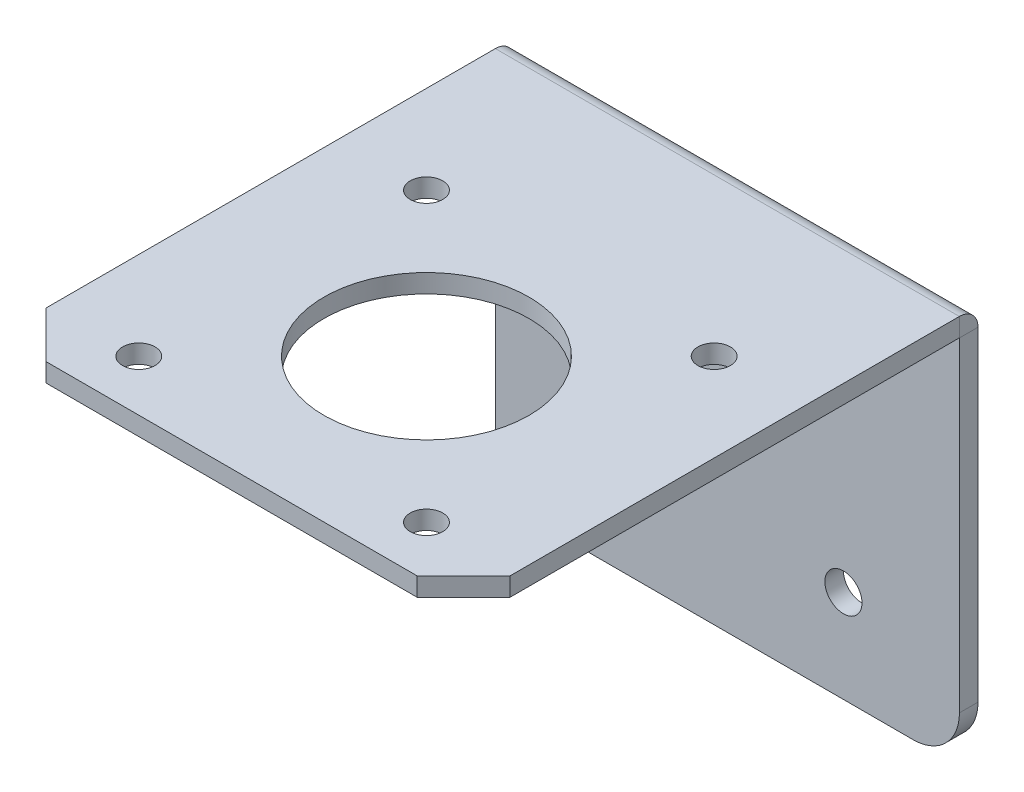
from build123d import *

# Parameters (mm, degrees)
SCHIZZO1_R                             = 1.75
SCHIZZO1_R_2                           = 11.05
SCHIZZO1_R_3                           = 2
BASE_FLANGIA1_DEPTH                    = 2
PIEGATURA_START                        = -5.5
PIEGATURA_DELLO_SCHIZZO1_OUTLINE_W     = 50
PIEGATURA_DELLO_SCHIZZO1_OUTLINE_H     = 2
PIEGATURA_DELLO_SCHIZZO1_DEPTH         = 53
PIEGATURA_START_2                      = -7.5
PIEGATURA_DELLO_SCHIZZO1_2_OUTLINE_R   = 1.75
PIEGATURA_DELLO_SCHIZZO1_2_OUTLINE_R_2 = 11.05
PIEGATURA_DELLO_SCHIZZO1_2_DEPTH       = 2
PIEGATURA_START_3                      = -26
PIEGATURA_DELLO_SCHIZZO1_3_DEPTH       = 52
PIEGATURA_START_4                      = -25
PIEGATURA_DELLO_SCHIZZO1_4_DEPTH       = 50


with BuildPart() as part:
    # Base-Flangia1: sheet metal written as solids
    # Schizzo1 → Base-Flangia1 (new body)
    with BuildSketch(Plane.XY):
        with BuildLine():
            Line((-25, 42.5), (-20, 47.5))
            Line((-20, 47.5), (20, 47.5))
            Line((20, 47.5), (25, 42.5))
            Line((25, 42.5), (25, -42.5))
            ThreePointArc((25, -42.5), (23.535533906, -46.035533906), (20, -47.5))
            Line((20, -47.5), (-20, -47.5))
            ThreePointArc((-20, -47.5), (-23.535533906, -46.035533906), (-25, -42.5))
            Line((-25, -42.5), (-25, 42.5))
        make_face()
        with Locations((-15.5, 42)):
            Circle(SCHIZZO1_R, mode=Mode.SUBTRACT)
        with Locations((15.5, 42)):
            Circle(SCHIZZO1_R, mode=Mode.SUBTRACT)
        with Locations((15.5, 11)):
            Circle(SCHIZZO1_R, mode=Mode.SUBTRACT)
        with Locations((-15.5, 11)):
            Circle(SCHIZZO1_R, mode=Mode.SUBTRACT)
        with Locations((0, 26.5)):
            Circle(SCHIZZO1_R_2, mode=Mode.SUBTRACT)
        with Locations((-12.5, -37.5)):
            Circle(SCHIZZO1_R_3, mode=Mode.SUBTRACT)
        with Locations((12.5, -37.5)):
            Circle(SCHIZZO1_R_3, mode=Mode.SUBTRACT)
    extrude(amount=-BASE_FLANGIA1_DEPTH)

    # Piegatura dello schizzo1: read off the stored shape, not the designer's step
    # Piegatura dello schizzo1 outline → Piegatura dello schizzo1 (cut)
    with BuildSketch(Plane(origin=(0, 0, 0), x_dir=(1, 0, 0), z_dir=(0, 1, 0)).offset(PIEGATURA_START)):
        with Locations((0, 1)):
            Rectangle(PIEGATURA_DELLO_SCHIZZO1_OUTLINE_W, PIEGATURA_DELLO_SCHIZZO1_OUTLINE_H)
    extrude(amount=PIEGATURA_DELLO_SCHIZZO1_DEPTH, mode=Mode.SUBTRACT)

    # Piegatura dello schizzo1 2 outline → Piegatura dello schizzo1 2 (add)
    with BuildSketch(Plane(origin=(0, 0, 0), x_dir=(1, 0, 0), z_dir=(0, 1, 0)).offset(PIEGATURA_START_2)):
        Polygon((-25, 0), (-25, -48.43349571), (-20, -53.43349571), (20, -53.43349571), (25, -48.43349571), (25, 0), align=None)
        with Locations((-15.5, -47.93349571)):
            Circle(PIEGATURA_DELLO_SCHIZZO1_2_OUTLINE_R, mode=Mode.SUBTRACT)
        with Locations((15.5, -47.93349571)):
            Circle(PIEGATURA_DELLO_SCHIZZO1_2_OUTLINE_R, mode=Mode.SUBTRACT)
        with Locations((0, -32.43349571)):
            Circle(PIEGATURA_DELLO_SCHIZZO1_2_OUTLINE_R_2, mode=Mode.SUBTRACT)
        with Locations((-15.5, -16.93349571)):
            Circle(PIEGATURA_DELLO_SCHIZZO1_2_OUTLINE_R, mode=Mode.SUBTRACT)
        with Locations((15.5, -16.93349571)):
            Circle(PIEGATURA_DELLO_SCHIZZO1_2_OUTLINE_R, mode=Mode.SUBTRACT)
    extrude(amount=PIEGATURA_DELLO_SCHIZZO1_2_DEPTH)

    # Piegatura dello schizzo1 3 outline → Piegatura dello schizzo1 3 (cut)
    with BuildSketch(Plane.YZ.offset(PIEGATURA_START_3)):
        with BuildLine():
            ThreePointArc((-5.5, 0.01), (-6.08871537, -1.41128463), (-7.51, -2))
            Line((-7.51, -2), (-5.5, -2))
            Line((-5.5, -2), (-5.5, 0.01))
        make_face()
    extrude(amount=PIEGATURA_DELLO_SCHIZZO1_3_DEPTH, mode=Mode.SUBTRACT)

    # Piegatura dello schizzo1 4 outline → Piegatura dello schizzo1 4 (add)
    with BuildSketch(Plane.YZ.offset(PIEGATURA_START_4)):
        with BuildLine():
            ThreePointArc((-7.5, 0.01), (-7.502928932, 0.002928932), (-7.51, 0))
            Line((-7.51, 0), (-7.5, 0))
            Line((-7.5, 0), (-7.5, 0.01))
        make_face()
    extrude(amount=PIEGATURA_DELLO_SCHIZZO1_4_DEPTH)


solid = part.part
